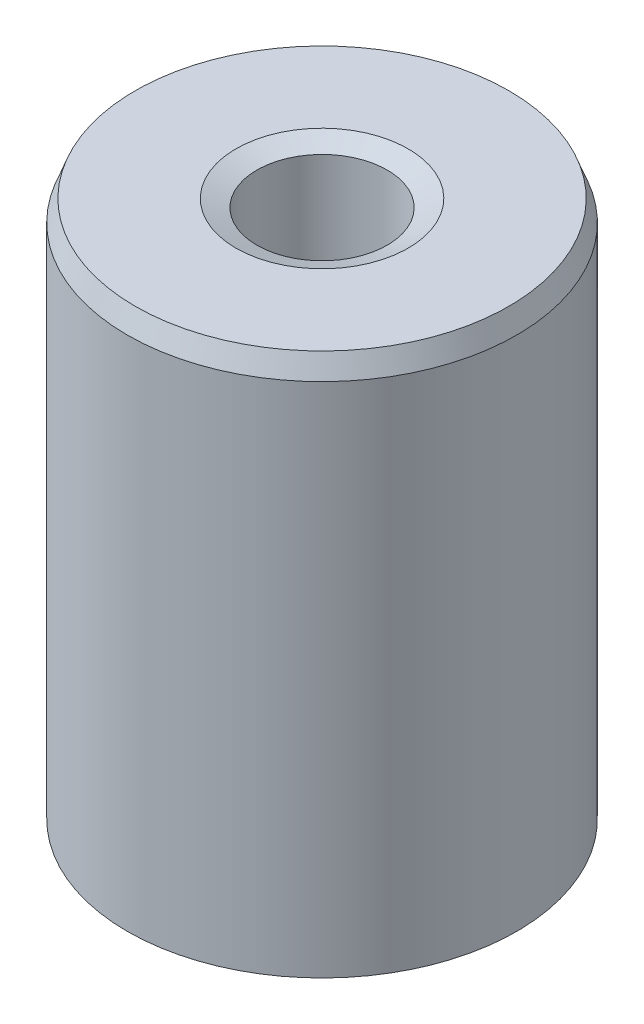
from build123d import *
from OCP.BRepFilletAPI import BRepFilletAPI_MakeChamfer

# Parameters (mm, degrees)
SKETCH1_R           = 10
BOSS_EXTRUDE1_DEPTH = 28.008082182
SKETCH2_R           = 3.34633372
CUT_EXTRUDE1_DEPTH  = 32.375988709
CHAMFER1_SIZE       = 1.076406989
CHAMFER1_SIZE2      = 0.405718925


with BuildPart() as part:
    # Sketch1 → Boss-Extrude1 (new body)
    with BuildSketch(Plane(origin=(0, 0, 0), x_dir=(1, 0, 0), z_dir=(0, 1, 0))):
        Circle(SKETCH1_R)
    extrude(amount=BOSS_EXTRUDE1_DEPTH)

    # Sketch2 → Cut-Extrude1 (cut, through all)
    with BuildSketch(Plane(origin=(0, 0, 0), x_dir=(1, 0, 0), z_dir=(0, 1, 0))):
        Circle(SKETCH2_R)
    extrude(amount=CUT_EXTRUDE1_DEPTH, mode=Mode.SUBTRACT)

    # Chamfer1: one chamfer whose edges measure the first distance from different faces: ONE call of the kernel's chamfer builder (chamfer() names one face for all edges)
    chamfer1_edges_1 = [part.edges().sort_by_distance(p)[0] for p in [
        (-3.34633372, 28.008082182, 0),
    ]]
    chamfer1_side_1 = [part.faces().sort_by_distance(p)[0] for p in [
        (-9.717157288, 28.008082182, 0),
    ]]
    chamfer1_edges_2 = [part.edges().sort_by_distance(p)[0] for p in [
        (-3.34633372, 0, 0),
    ]]
    chamfer1_side_2 = [part.faces().sort_by_distance(p)[0] for p in [
        (-3.34633372, 14.004041091, 0),
    ]]
    chamfer1_edges_3 = [part.edges().sort_by_distance(p)[0] for p in [
        (-10, 0, 0),
    ]]
    chamfer1_side_3 = [part.faces().sort_by_distance(p)[0] for p in [
        (-9.717157288, 0, 0),
    ]]
    chamfer1_edges_4 = [part.edges().sort_by_distance(p)[0] for p in [
        (-10, 28.008082182, 0),
    ]]
    chamfer1_side_4 = [part.faces().sort_by_distance(p)[0] for p in [
        (-10, 14.004041091, 0),
    ]]
    chamfer1 = BRepFilletAPI_MakeChamfer(part.part.solid().wrapped)
    for e in chamfer1_edges_1:
        chamfer1.Add(CHAMFER1_SIZE, CHAMFER1_SIZE2, e.wrapped, chamfer1_side_1[0].wrapped)  # the first distance lies on this face
    for e in chamfer1_edges_2:
        chamfer1.Add(CHAMFER1_SIZE, CHAMFER1_SIZE2, e.wrapped, chamfer1_side_2[0].wrapped)  # the first distance lies on this face
    for e in chamfer1_edges_3:
        chamfer1.Add(CHAMFER1_SIZE, CHAMFER1_SIZE2, e.wrapped, chamfer1_side_3[0].wrapped)  # the first distance lies on this face
    for e in chamfer1_edges_4:
        chamfer1.Add(CHAMFER1_SIZE, CHAMFER1_SIZE2, e.wrapped, chamfer1_side_4[0].wrapped)  # the first distance lies on this face
    add(Compound.cast(chamfer1.Shape()), mode=Mode.REPLACE)


solid = part.part
